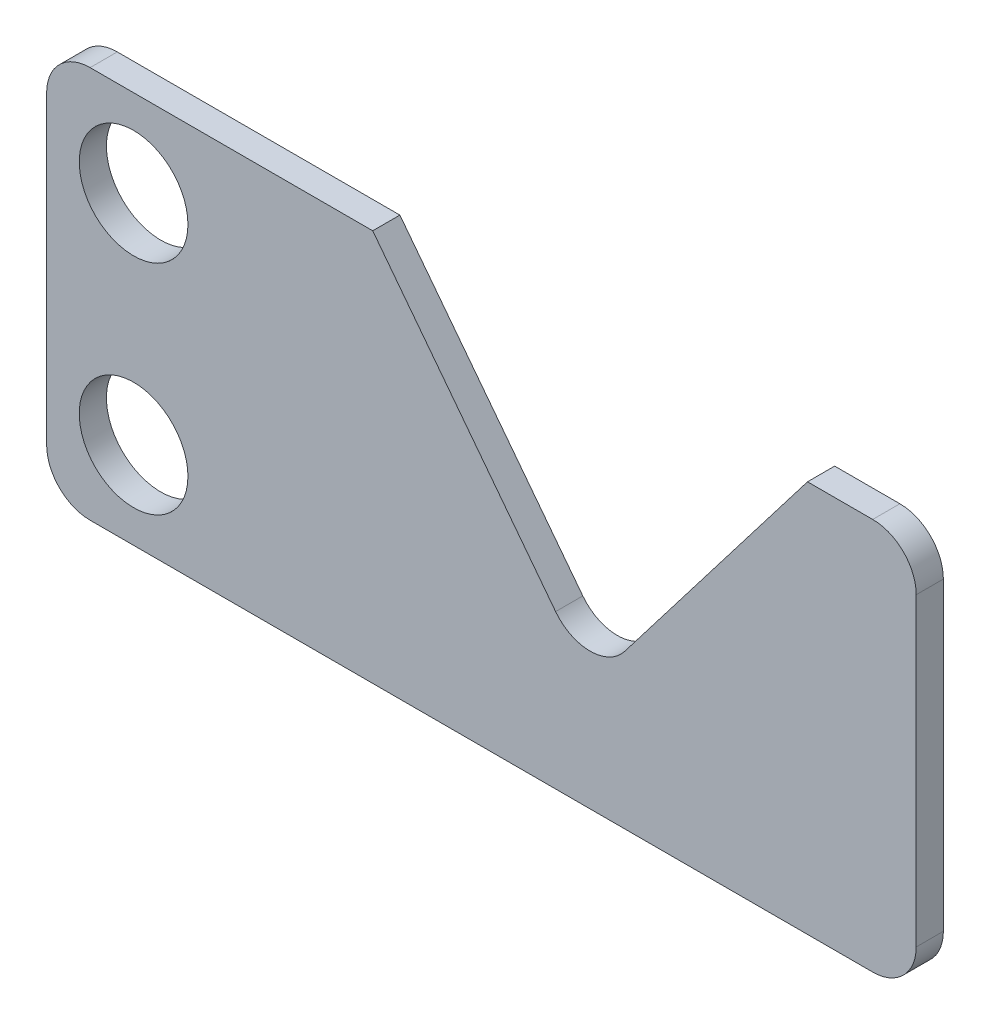
from build123d import *

# Parameters (mm, degrees)
SKETCH2_R           = 3.175
BOSS_EXTRUDE1_DEPTH = 1.5875


with BuildPart() as part:
    # Sketch2 → Boss-Extrude1 (new body)
    with BuildSketch(Plane.XY):
        with BuildLine():
            Line((19.05, 22.900962235), (29.734882516, 8.976152235))
            ThreePointArc((29.734882516, 8.976152235), (31.75, 7.982406265), (33.765117484, 8.976152235))
            Line((33.765117484, 8.976152235), (44.45, 22.900962235))
            Line((44.45, 22.900962235), (48.26, 22.900962235))
            ThreePointArc((48.26, 22.900962235), (50.056051224, 22.157013459), (50.8, 20.360962235))
            Line((50.8, 20.360962235), (50.8, 2.54))
            ThreePointArc((50.8, 2.54), (50.056051224, 0.743948776), (48.26, 0))
            Line((48.26, 0), (2.54, 0))
            ThreePointArc((2.54, 0), (0.743948776, 0.743948776), (0, 2.54))
            Line((0, 2.54), (0, 20.360962235))
            ThreePointArc((0, 20.360962235), (0.743948776, 22.157013459), (2.54, 22.900962235))
            Line((2.54, 22.900962235), (19.05, 22.900962235))
        make_face()
        with Locations((5.08, 17.820962235)):
            Circle(SKETCH2_R, mode=Mode.SUBTRACT)
        with Locations((5.08, 5.08)):
            Circle(SKETCH2_R, mode=Mode.SUBTRACT)
    extrude(amount=BOSS_EXTRUDE1_DEPTH)


solid = part.part
